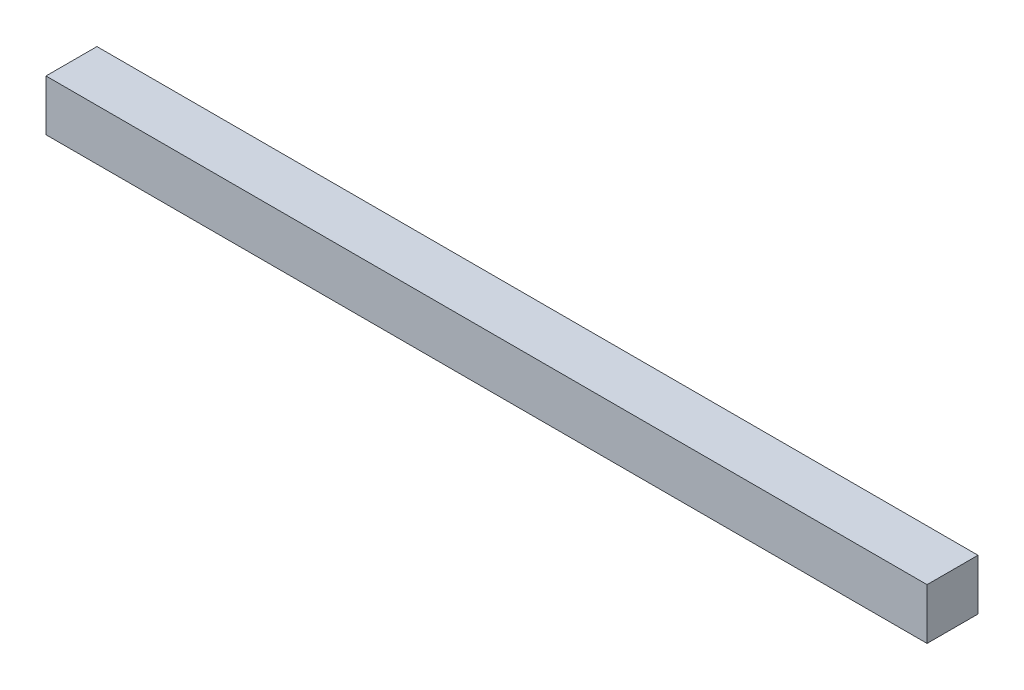
from build123d import *

# Parameters (mm, degrees)
ESQUISSE1_W        = 173
ESQUISSE1_H        = 10
BOSS_EXTRU_1_DEPTH = 10


with BuildPart() as part:
    # Esquisse1 → Boss.-Extru.1 (new body)
    with BuildSketch(Plane.XY):
        with Locations((-131.316611842, 69.791666667)):
            Rectangle(ESQUISSE1_W, ESQUISSE1_H)
    extrude(amount=BOSS_EXTRU_1_DEPTH)


solid = part.part
